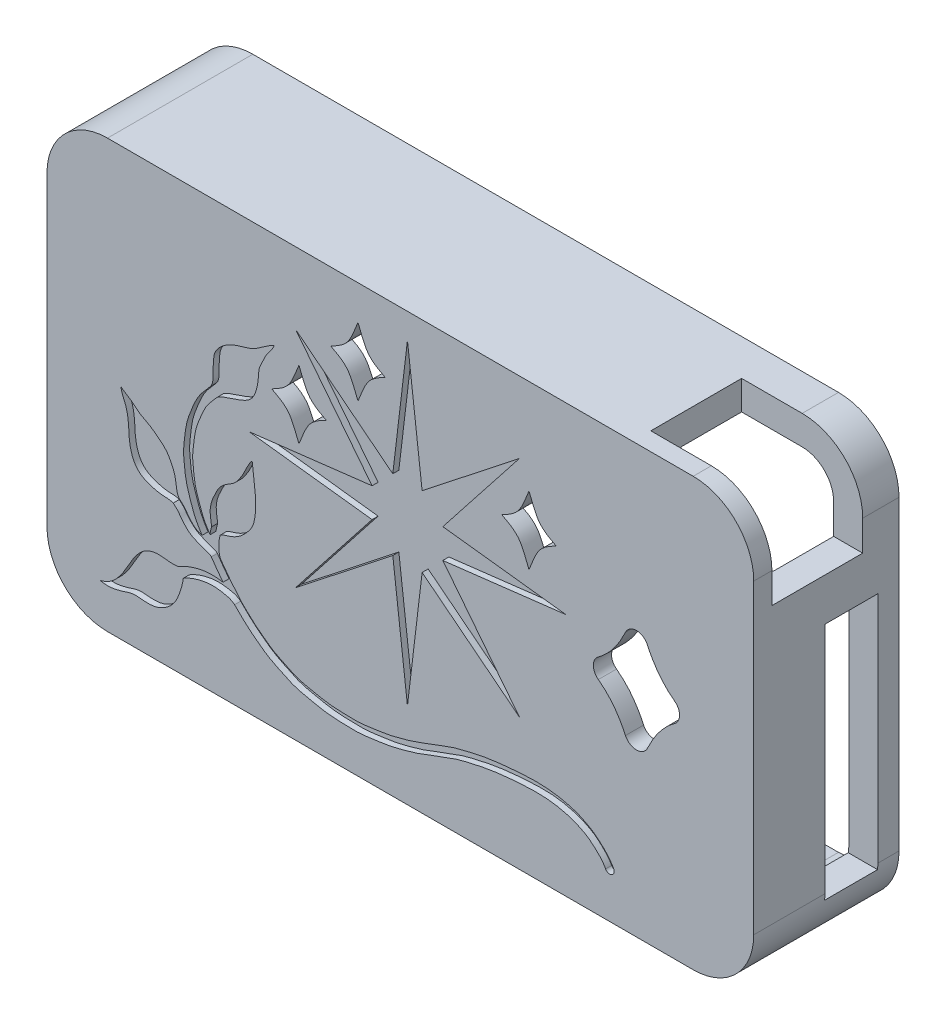
from build123d import *

# Parameters (mm, degrees)
SKETCH1_W              = 46.7
SKETCH1_H              = 28.24
BOSS_EXTRUDE1_DEPTH    = 9.6
FILLET1_R              = 4
SHELLCUT_DEPTH         = 8.4
STARSTHROUGHCUT_DEPTH  = 29.926750595
PCBSUPPORT_DEPTH       = 2
BTNCUT_DEPTH           = 29.926750725
SKETCH11_W             = 3.5
SKETCH11_H             = 15.8
CONNCUT_DEPTH          = 11
USB_DEPTH              = 11
CHAMFER1_SIZE          = 0.6
LATCH1_DEPTH           = 2.5
LPATTERN1_COUNT        = 2
LPATTERN1_PITCH        = 15.5
LPATTERN1_COPY_1_DEPTH = 2.5
LPATTERN2_COUNT        = 2
LPATTERN2_PITCH        = 15.5
LPATTERN2_COPY_1_DEPTH = 2.5
SKETCH15_W             = 9
SKETCH15_H             = 7
CUT_EXTRUDE3_DEPTH     = 6
CUT_EXTRUDE4_START     = -0.4
CUT_EXTRUDE4_DEPTH     = 0.4


with BuildPart() as part:
    # Sketch1 → Boss-Extrude1 (new body)
    with BuildSketch(Plane.XY):
        Rectangle(SKETCH1_W, SKETCH1_H)
    extrude(amount=BOSS_EXTRUDE1_DEPTH)

    # Fillet1
    fillet1_edges = [part.edges().sort_by_distance(p)[0] for p in [
        (23.35, -14.12, 4.8),
        (-23.35, -14.12, 4.8),
        (-23.35, 14.12, 4.8),
        (23.35, 14.12, 4.8),
    ]]
    fillet(fillet1_edges, radius=FILLET1_R)

    # Sketch6 → ShellCut (cut)
    with BuildSketch(Plane(origin=(0, 0, 0), x_dir=(-1, 0, 0), z_dir=(0, 0, -1))):
        with BuildLine():
            Line((-21.43, 10.12), (-21.43, -10.12))
            ThreePointArc((-21.43, -10.12), (-20.820782105, -11.590782105), (-19.35, -12.2))
            Line((-19.35, -12.2), (19.35, -12.2))
            ThreePointArc((19.35, -12.2), (20.820782105, -11.590782105), (21.43, -10.12))
            Line((21.43, -10.12), (21.43, 10.12))
            ThreePointArc((21.43, 10.12), (20.820782105, 11.590782105), (19.35, 12.2))
            Line((19.35, 12.2), (-19.35, 12.2))
            ThreePointArc((-19.35, 12.2), (-20.820782105, 11.590782105), (-21.43, 10.12))
        make_face()
    extrude(amount=-SHELLCUT_DEPTH, mode=Mode.SUBTRACT)

    # Sketch7 → StarsThroughCut (cut, through all)
    with BuildSketch(Plane.XY.offset(9.6)):
        with BuildLine():
            add(Edge.make_bspline(
                [(-6.7, 7.45), (-6.13809011, 6.059224218), (-6.088008699, 5.805320666), (-4.9, 5.2)],
                knots=[0, 0, 0, 0, 1, 1, 1, 1], degree=3))
            add(Edge.make_bspline(
                [(-6.7, 2.95), (-6.13809011, 4.340775782), (-6.088008699, 4.594679334), (-4.9, 5.2)],
                knots=[0, 0, 0, 0, 1, 1, 1, 1], degree=3))
            add(Edge.make_bspline(
                [(-6.7, 2.95), (-7.26190989, 4.340775782), (-7.311991301, 4.594679334), (-8.5, 5.2)],
                knots=[0, 0, 0, 0, 1, 1, 1, 1], degree=3))
            add(Edge.make_bspline(
                [(-6.7, 7.45), (-7.26190989, 6.059224218), (-7.311991301, 5.805320666), (-8.5, 5.2)],
                knots=[0, 0, 0, 0, 1, 1, 1, 1], degree=3))
        make_face()
        with BuildLine():
            add(Edge.make_bspline(
                [(-2.8, 11.85), (-2.23809011, 10.459224218), (-2.188008699, 10.205320666), (-1, 9.6)],
                knots=[0, 0, 0, 0, 1, 1, 1, 1], degree=3))
            add(Edge.make_bspline(
                [(-2.8, 7.35), (-2.23809011, 8.740775782), (-2.188008699, 8.994679334), (-1, 9.6)],
                knots=[0, 0, 0, 0, 1, 1, 1, 1], degree=3))
            add(Edge.make_bspline(
                [(-2.8, 7.35), (-3.36190989, 8.740775782), (-3.411991301, 8.994679334), (-4.6, 9.6)],
                knots=[0, 0, 0, 0, 1, 1, 1, 1], degree=3))
            add(Edge.make_bspline(
                [(-2.8, 11.85), (-3.36190989, 10.459224218), (-3.411991301, 10.205320666), (-4.6, 9.6)],
                knots=[0, 0, 0, 0, 1, 1, 1, 1], degree=3))
        make_face()
        with BuildLine():
            add(Edge.make_bspline(
                [(8.5, 7.85), (9.06190989, 6.459224218), (9.111991301, 6.205320666), (10.3, 5.6)],
                knots=[0, 0, 0, 0, 1, 1, 1, 1], degree=3))
            add(Edge.make_bspline(
                [(8.5, 3.35), (9.06190989, 4.740775782), (9.111991301, 4.994679334), (10.3, 5.6)],
                knots=[0, 0, 0, 0, 1, 1, 1, 1], degree=3))
            add(Edge.make_bspline(
                [(8.5, 3.35), (7.93809011, 4.740775782), (7.888008699, 4.994679334), (6.7, 5.6)],
                knots=[0, 0, 0, 0, 1, 1, 1, 1], degree=3))
            add(Edge.make_bspline(
                [(8.5, 7.85), (7.93809011, 6.459224218), (7.888008699, 6.205320666), (6.7, 5.6)],
                knots=[0, 0, 0, 0, 1, 1, 1, 1], degree=3))
        make_face()
    extrude(amount=-STARSTHROUGHCUT_DEPTH, mode=Mode.SUBTRACT)

    # Sketch8 → PCBSupport (add)
    with BuildSketch(Plane(origin=(0, 0, 8.4), x_dir=(-1, 0, 0), z_dir=(0, 0, -1))):
        with BuildLine():
            Line((-19.35, -11.2), (19.35, -11.2))
            ThreePointArc((19.35, -11.2), (20.113675324, -10.883675324), (20.43, -10.12))
            Line((20.43, -10.12), (20.43, 10.12))
            ThreePointArc((20.43, 10.12), (20.113675324, 10.883675324), (19.35, 11.2))
            Line((19.35, 11.2), (4.6, 11.2))
            Line((4.6, 11.2), (4.6, 12.4))
            Line((4.6, 12.4), (19.35, 12.4))
            ThreePointArc((19.35, 12.4), (20.962203461, 11.732203461), (21.63, 10.12))
            Line((21.63, 10.12), (21.63, -10.12))
            ThreePointArc((21.63, -10.12), (20.962203461, -11.732203461), (19.35, -12.4))
            Line((19.35, -12.4), (-19.35, -12.4))
            ThreePointArc((-19.35, -12.4), (-20.962203461, -11.732203461), (-21.63, -10.12))
            Line((-21.63, -10.12), (-21.63, 10.12))
            ThreePointArc((-21.63, 10.12), (-20.962203461, 11.732203461), (-19.35, 12.4))
            Line((-19.35, 12.4), (1, 12.4))
            Line((1, 12.4), (1, 11.2))
            Line((1, 11.2), (-19.35, 11.2))
            ThreePointArc((-19.35, 11.2), (-20.113675324, 10.883675324), (-20.43, 10.12))
            Line((-20.43, 10.12), (-20.43, -10.12))
            ThreePointArc((-20.43, -10.12), (-20.113675324, -10.883675324), (-19.35, -11.2))
        make_face()
    extrude(amount=PCBSUPPORT_DEPTH)

    # Sketch10 → BtnCut (cut, through all)
    with BuildSketch(Plane.XY.offset(9.6)):
        with BuildLine():
            ThreePointArc((13.082330478, 0.646697998), (12.753267522, 0), (13.082330478, -0.646697998))
            add(Edge.make_bspline(
                [(13.082330478, -0.646697998), (13.481379317, -0.937292497), (13.829564495, -1.291002967), (14.42269291, -2.077034455), (14.667086452, -2.505763707), (14.873619567, -2.953297473)],
                knots=[0, 0, 0, 0, 0.5, 0.5, 1, 1, 1, 1], degree=3))
            ThreePointArc((14.873619567, -2.953297473), (15.6, -3.418078938), (16.326380433, -2.953297473))
            add(Edge.make_bspline(
                [(16.326380433, -2.953297473), (16.53312097, -2.505314246), (16.778501928, -2.075075647), (17.223936546, -1.485336958), (17.385361961, -1.298270105), (17.732060383, -0.952102545), (17.917939404, -0.792145041), (18.117669522, -0.646697998)],
                knots=[0, 0, 0, 0, 0.5, 0.5, 0.75, 0.75, 1, 1, 1, 1], degree=3))
            ThreePointArc((18.117669522, -0.646697998), (18.446732478, 0), (18.117669522, 0.646697998))
            add(Edge.make_bspline(
                [(18.117669522, 0.646697998), (17.718620683, 0.937292497), (17.370435505, 1.291002967), (16.77730709, 2.077034455), (16.532913548, 2.505763707), (16.326380433, 2.953297473)],
                knots=[0, 0, 0, 0, 0.5, 0.5, 1, 1, 1, 1], degree=3))
            ThreePointArc((16.326380433, 2.953297473), (15.6, 3.418078938), (14.873619567, 2.953297473))
            add(Edge.make_bspline(
                [(14.873619567, 2.953297473), (14.66687903, 2.505314246), (14.421498072, 2.075075647), (13.976063454, 1.485336958), (13.814638039, 1.298270105), (13.467939617, 0.952102545), (13.282060596, 0.792145041), (13.082330478, 0.646697998)],
                knots=[0, 0, 0, 0, 0.5, 0.5, 0.75, 0.75, 1, 1, 1, 1], degree=3))
        make_face()
    extrude(amount=-BTNCUT_DEPTH, mode=Mode.SUBTRACT)

    # Sketch11 → ConnCut (cut)
    with BuildSketch(Plane(origin=(23.35, 0, 0), x_dir=(0, 0, -1), z_dir=(1, 0, 0))):
        with Locations((-3.15, -2.6)):
            Rectangle(SKETCH11_W, SKETCH11_H)
    extrude(amount=-CONNCUT_DEPTH, mode=Mode.SUBTRACT)

    # Sketch12 → USB (cut)
    with BuildSketch(Plane.ZY.offset(23.35)):
        Polygon((1.7, -4.1), (1.7, 4.1), (3.7, 4.1), (5, 3), (5, -3), (3.7, -4.1), align=None)
    extrude(amount=-USB_DEPTH, mode=Mode.SUBTRACT)

    # Chamfer1
    chamfer1_edges = [part.edges().sort_by_distance(p)[0] for p in [
        (-22.39, -4.1, 1.7),
        (-22.39, 4.1, 1.7),
    ]]
    chamfer(chamfer1_edges, length=CHAMFER1_SIZE)

    # Sketch13 → Latch1 (cut, symmetric)
    with BuildSketch(Plane(origin=(0, 0, 0), x_dir=(0, 0, -1), z_dir=(1, 0, 0))):
        Polygon((-1.5, 12.1), (-1.5, 13.14), (-0.827239199, 13.14), (-0.226794919, 12.1), align=None)
    latch1 = extrude(amount=LATCH1_DEPTH, both=True, mode=Mode.SUBTRACT)

    # Mirror1: Latch1 across plane
    add(latch1.mirror(Plane.ZX), mode=Mode.SUBTRACT)

    # LPattern1: Latch1 ×2
    with Locations(*[(i * LPATTERN1_PITCH, 0, 0) for i in range(1, LPATTERN1_COUNT)]):
        add(latch1, mode=Mode.SUBTRACT)

    # LPattern1 copy 1 sketch → LPattern1 copy 1 (cut, symmetric)
    with BuildSketch(Plane(origin=(15.5, 0, 0), x_dir=(0, 0, -1), z_dir=(1, 0, 0))):
        Polygon((-1.5, -12.1), (-1.5, -13.14), (-0.827239199, -13.14), (-0.226794919, -12.1), align=None)
    extrude(amount=LPATTERN1_COPY_1_DEPTH, both=True, mode=Mode.SUBTRACT)

    # LPattern2: Latch1 ×2
    with Locations(*[(-i * LPATTERN2_PITCH, 0, 0) for i in range(1, LPATTERN2_COUNT)]):
        add(latch1, mode=Mode.SUBTRACT)

    # LPattern2 copy 1 sketch → LPattern2 copy 1 (cut, symmetric)
    with BuildSketch(Plane(origin=(-15.5, 0, 0), x_dir=(0, 0, -1), z_dir=(1, 0, 0))):
        Polygon((-1.5, -12.1), (-1.5, -13.14), (-0.827239199, -13.14), (-0.226794919, -12.1), align=None)
    extrude(amount=LPATTERN2_COPY_1_DEPTH, both=True, mode=Mode.SUBTRACT)

    # Sketch15 → Cut-Extrude3 (cut)
    with BuildSketch(Plane(origin=(0, 0, 8.4), x_dir=(-1, 0, 0), z_dir=(0, 0, -1))):
        with Locations((-19.85, 11.62)):
            Rectangle(SKETCH15_W, SKETCH15_H)
    extrude(amount=CUT_EXTRUDE3_DEPTH, mode=Mode.SUBTRACT)

    # Cut-Extrude4: read off the stored shape, not the designer's step
    # Cut-Extrude4 outline → Cut-Extrude4 (cut)
    with BuildSketch(Plane.XY.offset(9.6).offset(CUT_EXTRUDE4_START)):
        with BuildLine():
            add(Edge.make_bspline(
                [(-11.715044719, -7.475478086), (-11.851040751, -7.453487705), (-12.151264141, -7.414319597), (-12.86324304, -7.408956857), (-13.695878783, -7.592757839), (-14.36671105, -7.870032966), (-14.666091288, -8.058632594)],
                knots=[0.274313646, 0.274313646, 0.274313646, 0.274313646, 0.375, 0.5, 0.75, 1, 1, 1, 1], degree=3))
            add(Edge.make_bspline(
                [(-14.666091288, -8.058632594), (-15.117366708, -8.150160497), (-15.834248356, -7.908191613), (-16.920822601, -8.18404248), (-17.606776551, -8.952100313), (-18.297942749, -10.26479528), (-18.992487117, -11.242764695), (-19.845192862, -11.435758852)],
                knots=[0, 0, 0, 0, 0.202427742, 0.327230672, 0.479575622, 0.646805047, 1, 1, 1, 1], degree=3))
            add(Edge.make_bspline(
                [(-19.845192862, -11.435758852), (-19.272882823, -11.566195365), (-18.572599864, -11.402568216), (-17.656054527, -11.071721832), (-16.990999877, -11.161561965), (-16.193403914, -11.181651786), (-15.454790849, -10.835310097), (-14.933644936, -10.31036029), (-14.685011052, -9.810513206), (-14.488201791, -9.23890414), (-14.370622149, -8.845189454), (-14.346089787, -8.566174749)],
                knots=[0, 0, 0, 0, 0.234526212, 0.309363835, 0.40883733, 0.515027255, 0.646144067, 0.742116113, 0.825666415, 0.881346802, 1, 1, 1, 1], degree=3))
            add(Edge.make_bspline(
                [(-14.346089787, -8.566174749), (-14.091648471, -8.405751419), (-13.541547241, -8.174057682), (-12.755706663, -8.007889799), (-12.191990223, -8.011706058), (-11.540386817, -8.100030164), (-11.163681808, -8.207664569), (-10.954460916, -8.380165739)],
                knots=[0, 0, 0, 0, 0.25, 0.5, 0.625, 0.75, 0.997966029, 0.997966029, 0.997966029, 0.997966029], degree=3))
            add(Edge.make_bspline(
                [(-10.954460916, -8.380165739), (-10.918685215, -8.419371689), (-10.84617893, -8.497231051), (-10.651025515, -8.695046416), (-10.329854132, -8.989365784), (-9.91233831, -9.381937681), (-9.375628057, -9.761039), (-8.921915012, -10.13117548), (-8.301145559, -10.469272632), (-7.783591713, -10.709162949), (-7.202848759, -11.006645364), (-6.569638832, -11.193562584), (-5.95867964, -11.317419801), (-5.357774879, -11.444727813), (-4.730576685, -11.551454856), (-4.088881734, -11.590371573), (-3.483907836, -11.602027821), (-2.853612141, -11.629595214), (-2.196366754, -11.560715651), (-1.606168363, -11.469160477), (-0.777680965, -11.370019394), (0.249322286, -11.11714487), (1.234493577, -10.823090729), (2.02359564, -10.513901927), (2.57098002, -10.291220822), (3.153968044, -10.09782966), (3.728156689, -9.875210395), (4.273809071, -9.741458152), (5.103306301, -9.544638108), (6.04275447, -9.36015959), (7.28090703, -9.218591502), (8.454349412, -9.13587192), (9.485038427, -9.131793818), (10.23318724, -9.221488938), (10.840213586, -9.349516963), (11.376103136, -9.489846413), (11.921877502, -9.740881249), (12.408343296, -10.005367921), (13.008330913, -10.511114633), (13.389894643, -10.915650069), (13.56326864, -11.244115544)],
                knots=[0, 0, 0, 0, 0.00390625, 0.0078125, 0.020438004, 0.036063004, 0.051688004, 0.067313004, 0.082938004, 0.098563004, 0.114188004, 0.129813004, 0.145438004, 0.161063004, 0.176688004, 0.192313004, 0.207938004, 0.223563004, 0.239188004, 0.254813004, 0.270438004, 0.301688004, 0.332938004, 0.348563004, 0.364188004, 0.379813004, 0.395438004, 0.411063004, 0.426688004, 0.457938004, 0.489188004, 0.520438004, 0.551688004, 0.567313004, 0.582938004, 0.598563004, 0.614188004, 0.629813004, 0.645438004, 0.676688004, 0.676688004, 0.676688004, 0.676688004], degree=3))
            ThreePointArc((13.56326864, -11.244115544), (13.968434906, -11.36933261), (14.093655726, -10.964167505))
            add(Edge.make_bspline(
                [(14.093655726, -10.964167505), (13.988183189, -10.764335682), (13.719267558, -10.386326009), (13.256617815, -9.935730467), (12.762203162, -9.51736464), (12.173137925, -9.194451081), (11.598827309, -8.93074782), (10.950890358, -8.758282268), (10.354265286, -8.633146025), (9.484041638, -8.52752432), (8.457871037, -8.536822032), (7.195213, -8.620923378), (6.187686945, -8.746420918), (5.359931765, -8.869465014), (4.736262701, -9.01860631), (4.167020828, -9.148494395), (3.523440478, -9.309698635), (2.95268813, -9.532839799), (2.372418993, -9.724512215), (1.784509282, -9.962914865), (1.052109825, -10.250334257), (0.078644845, -10.541134997), (-0.881295035, -10.77784439), (-1.674458826, -10.873026332), (-2.298855479, -10.96809487), (-2.858975, -11.027575384), (-3.455697808, -11.002887711), (-4.079433707, -10.989792344), (-4.658953575, -10.954428655), (-5.237618011, -10.85652311), (-5.840031076, -10.729404676), (-6.438140993, -10.606882248), (-6.977825997, -10.447066608), (-7.487917508, -10.187077602), (-8.086914122, -9.902753835), (-8.539827979, -9.662174974), (-9.04844377, -9.257803291), (-9.511390609, -8.933653), (-9.962984773, -8.511459791), (-10.396303355, -8.115375316), (-10.910778109, -7.518604238), (-11.3582151, -6.965877034), (-11.711258041, -6.477892525), (-11.827031121, -6.311824278), (-11.884426934, -6.228609088)],
                knots=[0, 0, 0, 0, 0.015625, 0.03125, 0.046875, 0.0625, 0.078125, 0.09375, 0.109375, 0.125, 0.15625, 0.1875, 0.21875, 0.234375, 0.25, 0.265625, 0.28125, 0.296875, 0.3125, 0.328125, 0.34375, 0.375, 0.40625, 0.421875, 0.4375, 0.453125, 0.46875, 0.484375, 0.5, 0.515625, 0.53125, 0.546875, 0.5625, 0.578125, 0.59375, 0.609375, 0.625, 0.640625, 0.65625, 0.671875, 0.6875, 0.71875, 0.726605637, 0.734408048, 0.734408048, 0.734408048, 0.734408048], degree=3))
            add(Edge.make_bspline(
                [(-11.884426934, -6.228609088), (-11.966004377, -6.022373104), (-12.024355629, -5.566410544), (-11.97619058, -5.096525138), (-11.900963569, -4.874270875)],
                knots=[0.018228514, 0.018228514, 0.018228514, 0.018228514, 0.5, 1, 1, 1, 1], degree=3))
            add(Edge.make_bspline(
                [(-11.900963569, -4.874270875), (-11.6764384, -4.732121197), (-11.211983979, -4.645533026), (-10.590230875, -4.312546678), (-10.146215719, -3.862289363), (-9.753741174, -3.366893014), (-9.608038158, -2.761462018), (-9.530547925, -2.004594858), (-9.608628885, -0.927473034), (-9.751184763, -0.083226004), (-9.79163806, 0.425735411)],
                knots=[0, 0, 0, 0, 0.120927412, 0.215999725, 0.320757527, 0.412229152, 0.503510201, 0.60320625, 0.764420066, 1, 1, 1, 1], degree=3))
            add(Edge.make_bspline(
                [(-9.79163806, 0.425735411), (-10.030705828, 0.170036713), (-10.20731854, -0.326529109), (-10.555479927, -0.912944948), (-10.800119291, -1.277960555), (-11.141251286, -1.56757328), (-11.592062928, -1.798163294), (-11.983085953, -2.179311323), (-12.23309689, -2.655420459), (-12.450156366, -3.12318328), (-12.634105875, -3.828833535), (-12.507672819, -4.365352597), (-12.469291217, -4.681907456)],
                knots=[0, 0, 0, 0, 0.171371853, 0.25330748, 0.337423949, 0.386108406, 0.472215402, 0.586498335, 0.647574079, 0.736678287, 0.841356179, 1, 1, 1, 1], degree=3))
            add(Edge.make_bspline(
                [(-12.469291217, -4.681907456), (-12.525450462, -4.846787755), (-12.560861953, -5.02009679), (-12.580327498, -5.19473907)],
                knots=[0, 0, 0, 0, 0.287932093, 0.287932093, 0.287932093, 0.287932093], degree=3))
            add(Edge.make_bspline(
                [(-12.580327498, -5.19473907), (-12.683275241, -5.034187086), (-12.88428606, -4.703990988), (-13.126660173, -4.202869216), (-13.299892396, -3.640232853), (-13.520199706, -3.033502684), (-13.61215056, -2.540316167), (-13.686460747, -1.866847884), (-13.742443268, -1.343708126), (-13.684762588, -0.737885789), (-13.616822589, -0.145979017), (-13.514546713, 0.434138061), (-13.325190114, 0.951505797), (-13.076289012, 1.543461332), (-12.847429552, 2.033779938), (-12.489442729, 2.481127935), (-12.210177939, 2.787695187), (-12.076934403, 2.941084067)],
                knots=[0.766410156, 0.766410156, 0.766410156, 0.766410156, 0.78125, 0.796875, 0.8125, 0.828125, 0.84375, 0.859375, 0.875, 0.890625, 0.90625, 0.921875, 0.9375, 0.953125, 0.96875, 0.984375, 1, 1, 1, 1], degree=3))
            add(Edge.make_bspline(
                [(-12.076934403, 2.941084067), (-11.880673692, 3.078502614), (-11.462234156, 3.210658306), (-10.858520873, 3.419196315), (-10.313698389, 3.608429137), (-9.804990735, 3.931789728), (-9.480419, 4.614174063), (-9.371839143, 5.317928492), (-9.358079011, 5.977615567), (-9.09743913, 6.437042736), (-8.850445241, 7.070982861), (-8.442322165, 7.456970434), (-8.333290642, 7.764324704)],
                knots=[0, 0, 0, 0, 0.107464467, 0.197264369, 0.289730055, 0.369350689, 0.462, 0.619670235, 0.69321392, 0.754658505, 0.855136442, 1, 1, 1, 1], degree=3))
            add(Edge.make_bspline(
                [(-8.333290642, 7.764324704), (-8.707049407, 7.59327861), (-9.179694645, 7.198838791), (-9.886920798, 6.778138821), (-10.860449543, 6.55349509), (-11.800265379, 6.143794831), (-12.311594527, 5.350380965), (-12.34707485, 4.84708109), (-12.384826681, 4.350665411), (-12.359432509, 3.828237901), (-12.426006792, 3.480822582), (-12.529774105, 3.334510349)],
                knots=[0, 0, 0, 0, 0.180772384, 0.274474528, 0.361311749, 0.625942762, 0.699706232, 0.767491009, 0.846497256, 0.922001113, 1, 1, 1, 1], degree=3))
            add(Edge.make_bspline(
                [(-12.529774105, 3.334510349), (-12.664317207, 3.179721475), (-12.933243705, 2.885149516), (-13.353220402, 2.366918696), (-13.64218104, 1.749252542), (-13.871133503, 1.205105864), (-14.101872897, 0.574708526), (-14.212041097, -0.061102852), (-14.282292248, -0.681716278), (-14.347202273, -1.305827625), (-14.276913577, -1.99751885), (-14.22000829, -2.550096749), (-14.086872279, -3.254013557), (-13.876586571, -3.807227109), (-13.692285144, -4.415580835), (-13.414879261, -4.988954202), (-13.207871262, -5.332443942), (-13.106900999, -5.491052952)],
                knots=[0.767209488, 0.767209488, 0.767209488, 0.767209488, 0.782834488, 0.798459488, 0.814084488, 0.829709488, 0.845334488, 0.860959488, 0.876584488, 0.892209488, 0.907834488, 0.923459488, 0.939084488, 0.954709488, 0.970334488, 0.985959488, 1, 1, 1, 1], degree=3))
            add(Edge.make_bspline(
                [(-13.106900999, -5.491052952), (-13.155000224, -5.474261363), (-13.327175654, -5.413584723), (-13.500904937, -5.332856629), (-13.660663934, -5.198818036), (-13.8036223, -5.060256951), (-13.92770341, -4.930396468), (-14.022803578, -4.805274288), (-14.132235708, -4.631307446), (-14.345439516, -4.36535872), (-14.497967882, -4.240295087), (-14.60483192, -4.14422931)],
                knots=[0.328473801, 0.328473801, 0.328473801, 0.328473801, 0.375, 0.5, 0.5625, 0.625, 0.6875, 0.75, 0.8125, 0.875, 1, 1, 1, 1], degree=3))
            add(Edge.make_bspline(
                [(-14.60483192, -4.14422931), (-14.746738281, -3.938227939), (-14.81081954, -3.532731514), (-14.878665226, -2.925594058), (-15.119832819, -2.381032954), (-15.4378145, -1.780462235), (-16.038898286, -1.303100309), (-16.601272324, -0.875622557), (-17.226633134, -0.605818467), (-17.729600807, -0.0948546), (-18.219393392, 0.128565327), (-18.45996016, 0.348138047)],
                knots=[0, 0, 0, 0, 0.117816729, 0.195245101, 0.294001183, 0.403123196, 0.519043045, 0.659200663, 0.744334028, 0.843981418, 1, 1, 1, 1], degree=3))
            add(Edge.make_bspline(
                [(-18.45996016, 0.348138047), (-18.434400448, 0.037156744), (-18.195254482, -0.363977121), (-18.025874936, -0.988587254), (-17.946743894, -1.58728879), (-17.936917021, -2.321598885), (-17.813506124, -3.036940638), (-17.55959696, -3.624831373), (-17.220311939, -4.010888632), (-16.773403636, -4.242617092), (-16.289997519, -4.405443388), (-15.691782999, -4.532898864), (-15.242300932, -4.494758467), (-15.006046586, -4.590353499)],
                knots=[0, 0, 0, 0, 0.132174591, 0.199242453, 0.279999807, 0.393862702, 0.518236064, 0.592318925, 0.669804575, 0.735762577, 0.808531761, 0.891358917, 1, 1, 1, 1], degree=3))
            add(Edge.make_bspline(
                [(-15.006046586, -4.590353499), (-14.913008758, -4.674030821), (-14.755405916, -4.811444908), (-14.633404624, -4.964437923), (-14.526613446, -5.132260369), (-14.379528666, -5.328452747), (-14.22346682, -5.488946425), (-14.075877045, -5.633300919), (-13.825838477, -5.846712976), (-13.4348717, -6.0202703), (-13.100122926, -6.126174195), (-12.676339518, -6.296723163), (-12.547909613, -6.351313494), (-12.492218855, -6.407523102)],
                knots=[0, 0, 0, 0, 0.125, 0.1875, 0.25, 0.3125, 0.375, 0.4375, 0.5, 0.625, 0.75, 0.875, 0.991401695, 0.991401695, 0.991401695, 0.991401695], degree=3))
            add(Edge.make_bspline(
                [(-12.492218855, -6.407523102), (-12.337611558, -6.634158786), (-12.116256707, -6.952692656), (-11.849739447, -7.304352349), (-11.747198731, -7.434834204), (-11.715044719, -7.475478086)],
                knots=[0.706248427, 0.706248427, 0.706248427, 0.706248427, 0.727000496, 0.735595819, 0.739502069, 0.739502069, 0.739502069, 0.739502069], degree=3))
        make_face()
        Polygon((1.437836863, 4.337120448), (0.469258663, 12.461152968), (-0.499365257, 4.337120448), (-6.928740257, 9.396541368), (-1.869365057, 2.967166368), (-9.993123257, 1.998542448), (-1.869365057, 1.029872808), (-6.928740257, -5.399730792), (-0.499365257, -0.340035552), (0.469258663, -8.464068072), (1.437836863, -0.340035552), (7.867211863, -5.399730792), (2.807836663, 1.029872808), (10.931823463, 1.998542448), (2.807836663, 2.967166368), (7.867211863, 9.396541368), align=None)
    extrude(amount=CUT_EXTRUDE4_DEPTH, mode=Mode.SUBTRACT)


solid = part.part
